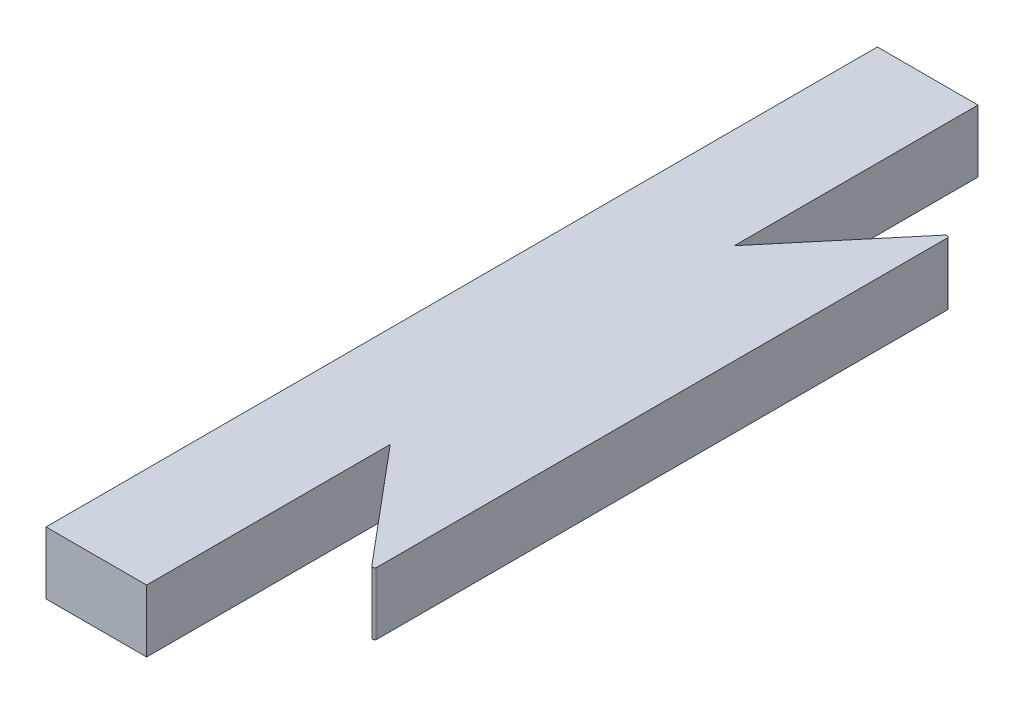
from build123d import *

# Parameters (mm, degrees)
CROQUIS1_R                 = 11
CROQUIS1_R_2               = 2
CROQUIS1_W                 = 30
CROQUIS1_H                 = 3
SALIENTE_EXTRUIR1_DEPTH    = 3
CROQUIS2_R                 = 13
CROQUIS2_R_2               = 11
SALIENTE_EXTRUIR2_DEPTH    = 4
CROQUIS3_R                 = 13
CROQUIS3_R_2               = 9
SALIENTE_EXTRUIR3_DEPTH    = 2
CHAFL_N1_SIZE              = 2
CHAFL_N2_SIZE              = 10
CORTAR_EXTRUIR1_DEPTH      = 10
CORTAR_EXTRUIR1_DEPTH_BACK = 10
CROQUIS4_W                 = 128.833311542
CROQUIS4_H                 = 58.233807115
REDONDEO1_R                = 0.1


with BuildPart() as part:
    # Croquis1 → Saliente-Extruir1 (new body)
    with BuildSketch(Plane(origin=(0, 0, 0), x_dir=(1, 0, 0), z_dir=(0, 1, 0))):
        Polygon((65, 8.279582756), (69.8, 14), (69.8, -14), (65, -8.279582756), (65, -20), (-65, -20), (-65, 20), (65, 20), align=None)
        with Locations((-50.129942902, 0)):
            Circle(CROQUIS1_R, mode=Mode.SUBTRACT)
        with Locations((-28.595127909, 0)):
            Circle(CROQUIS1_R_2, mode=Mode.SUBTRACT)
        with Locations((-13.595127909, 0)):
            Circle(CROQUIS1_R_2, mode=Mode.SUBTRACT)
        with Locations((50, 0)):
            Circle(CROQUIS1_R_2, mode=Mode.SUBTRACT)
        with Locations((25, 11)):
            Rectangle(CROQUIS1_W, CROQUIS1_H, mode=Mode.SUBTRACT)
        with Locations((25, -11)):
            Rectangle(CROQUIS1_W, CROQUIS1_H, mode=Mode.SUBTRACT)
    extrude(amount=SALIENTE_EXTRUIR1_DEPTH)

    # Croquis2 → Saliente-Extruir2 (add)
    with BuildSketch(Plane(origin=(0, 3, 0), x_dir=(1, 0, 0), z_dir=(0, 1, 0))):
        with Locations((-50.129942902, 0)):
            Circle(CROQUIS2_R)
        with Locations((-50.129942902, 0)):
            Circle(CROQUIS2_R_2, mode=Mode.SUBTRACT)
    extrude(amount=SALIENTE_EXTRUIR2_DEPTH)

    # Croquis3 → Saliente-Extruir3 (add)
    with BuildSketch(Plane(origin=(0, 7, 0), x_dir=(1, 0, 0), z_dir=(0, 1, 0))):
        with Locations((-50.129942902, 0)):
            Circle(CROQUIS3_R)
        with Locations((-50.129942902, 0)):
            Circle(CROQUIS3_R_2, mode=Mode.SUBTRACT)
    extrude(amount=SALIENTE_EXTRUIR3_DEPTH)

    # Chaflán1
    chafl_n1_edges = [part.edges().sort_by_distance(p)[0] for p in [
        (-63.129942902, 9, 0),
    ]]
    chamfer(chafl_n1_edges, length=CHAFL_N1_SIZE)

    # Chaflán2
    chafl_n2_edges = [part.edges().sort_by_distance(p)[0] for p in [
        (-65, 1.5, 20),
        (-65, 1.5, -20),
    ]]
    chamfer(chafl_n2_edges, length=CHAFL_N2_SIZE)

    # Croquis4 → Cortar-Extruir1 (cut, two sides: drawn at the far end of the back side and taken through both)
    with BuildSketch(Plane(origin=(0, 3, 0), x_dir=(1, 0, 0), z_dir=(0, 1, 0)).offset(-CORTAR_EXTRUIR1_DEPTH_BACK)):
        with Locations((-4.257997369, -0.71893589)):
            Rectangle(CROQUIS4_W, CROQUIS4_H)
    extrude(amount=CORTAR_EXTRUIR1_DEPTH + CORTAR_EXTRUIR1_DEPTH_BACK, mode=Mode.SUBTRACT)

    # Redondeo1
    redondeo1_edges = [part.edges().sort_by_distance(p)[0] for p in [
        (69.8, 1.5, -14),
        (69.8, 1.5, 14),
    ]]
    fillet(redondeo1_edges, radius=REDONDEO1_R)


solid = part.part
